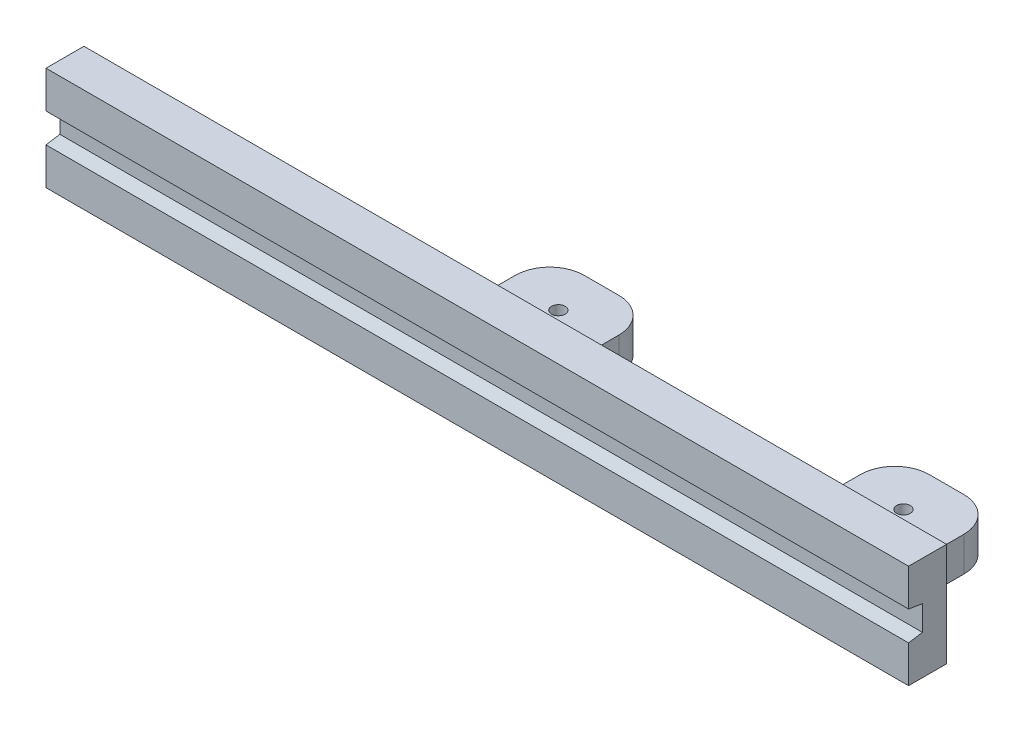
from build123d import *

# Parameters (mm, degrees)
SKETCH_1_W          = 250
SKETCH_1_H          = 30
EXTRUDE_1_DEPTH     = 11
SKETCH_4_W          = 30
SKETCH_4_H          = 10
EXTRUDE_2_DEPTH     = 25
CUT_EXTRUDE_2_DEPTH = 254.031618578
SKETCH_6_R          = 1.985
CUT_EXTRUDE_3_DEPTH = 253.041663223
EXTRUDE_4_DEPTH     = 25
SKETCH_12_R         = 1.985
CUT_EXTRUDE_5_DEPTH = 253.041663223
FILLET_1_R          = 10


with BuildPart() as part:
    # 草圖1 → 填料-伸長1 (new body)
    with BuildSketch(Plane.XY):
        with Locations((125, 15)):
            Rectangle(SKETCH_1_W, SKETCH_1_H)
    extrude(amount=EXTRUDE_1_DEPTH)

    # 草圖4 → 填料-伸長2 (add)
    with BuildSketch(Plane(origin=(0, 0, 0), x_dir=(-1, 0, 0), z_dir=(0, 0, -1))):
        with Locations((-125, 15)):
            Rectangle(SKETCH_4_W, SKETCH_4_H)
    extrude(amount=EXTRUDE_2_DEPTH)

    # 草圖5 → 除料-伸長2 (cut, through all)
    with BuildSketch(Plane(origin=(250, 0, 0), x_dir=(0, 0, -1), z_dir=(1, 0, 0))):
        Polygon((-11, 19.25), (-11, 10.75), (-7, 11.402039536), (-7, 18.6), align=None)
    extrude(amount=-CUT_EXTRUDE_2_DEPTH, mode=Mode.SUBTRACT)

    # 草圖6 → 除料-伸長3 (cut, through all)
    with BuildSketch(Plane.XZ.offset(-10)):
        with Locations((125, -12.5)):
            Circle(SKETCH_6_R)
    extrude(amount=-CUT_EXTRUDE_3_DEPTH, mode=Mode.SUBTRACT)

    # 草圖11 → 填料-伸長4 (add)
    with BuildSketch(Plane(origin=(0, 0, 0), x_dir=(-1, 0, 0), z_dir=(0, 0, -1))):
        Polygon((-240, 20), (-240, 10), (-210, 10), (-210, 15), (-210, 20), align=None)
    extrude(amount=EXTRUDE_4_DEPTH)

    # 草圖12 → 除料-伸長5 (cut, through all)
    with BuildSketch(Plane(origin=(0, 20, 0), x_dir=(1, 0, 0), z_dir=(0, 1, 0))):
        with Locations((225, 12.5)):
            Circle(SKETCH_12_R)
    extrude(amount=-CUT_EXTRUDE_5_DEPTH, mode=Mode.SUBTRACT)

    # 圓角1
    fillet_1_edges = [part.edges().sort_by_distance(p)[0] for p in [
        (110, 15, -25),
        (140, 15, -25),
        (210, 15, -25),
        (240, 15, -25),
    ]]
    fillet(fillet_1_edges, radius=FILLET_1_R)


solid = part.part
